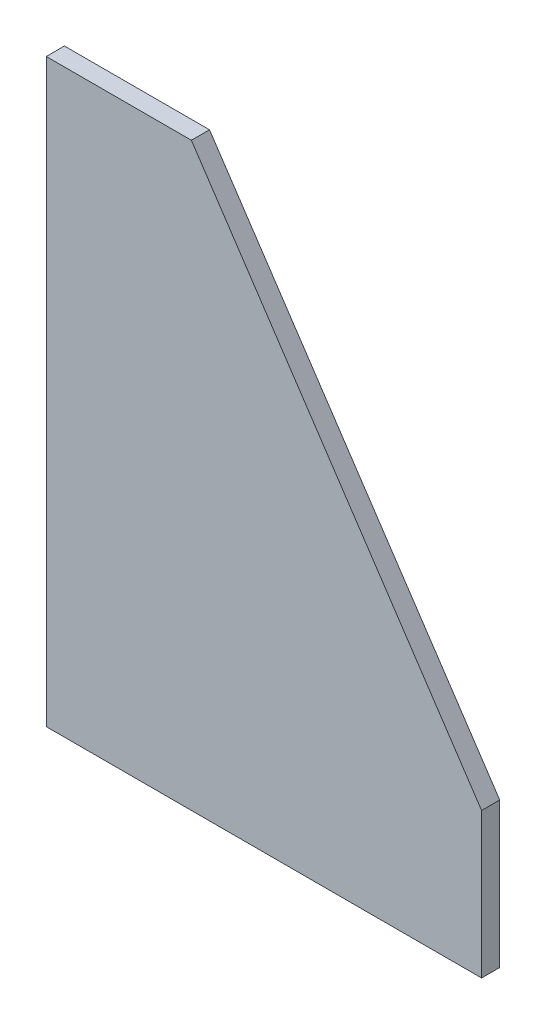
from build123d import *

# Parameters (mm, degrees)
BOSS_EXTRUDE1_DEPTH = 3.175


with BuildPart() as part:
    # Sketch1 (on Front Plane) → Boss-Extrude1 (new body)
    with BuildSketch(Plane.XY):
        Polygon((-12.7, -584.2), (-12.7, -482.6), (12.7, -482.6), (63.5, -558.8), (63.5, -584.2), align=None)
    extrude(amount=BOSS_EXTRUDE1_DEPTH)


solid = part.part
